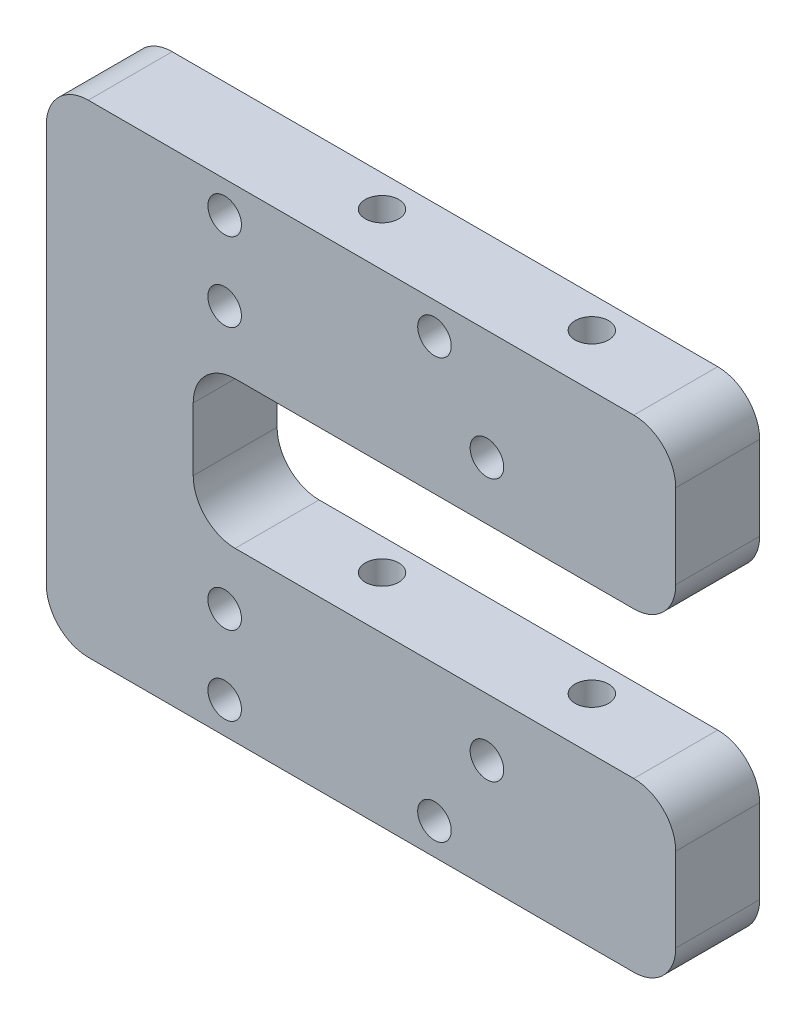
from build123d import *

# Parameters (mm, degrees)
SKETCH_1_R          = 1.6
EXTRUDE_1_DEPTH     = 8
FILLET_1_R          = 4
SKETCH_2_R          = 1.6
CUT_EXTRUDE_1_DEPTH = 10
SKETCH_3_R          = 1.6
CUT_EXTRUDE_2_DEPTH = 67


with BuildPart() as part:
    # 草图1 → 凸台-拉伸1 (new body)
    with BuildSketch(Plane.XY):
        Polygon((0, 46), (0, 0), (60, 0), (60, 16), (14, 16), (14, 30), (60, 30), (60, 46), align=None)
        with Locations((17, 35.5)):
            Circle(SKETCH_1_R, mode=Mode.SUBTRACT)
        with Locations((42, 35.5)):
            Circle(SKETCH_1_R, mode=Mode.SUBTRACT)
        with Locations((42, 10.5)):
            Circle(SKETCH_1_R, mode=Mode.SUBTRACT)
        with Locations((17, 10.5)):
            Circle(SKETCH_1_R, mode=Mode.SUBTRACT)
    extrude(amount=EXTRUDE_1_DEPTH)

    # 圆角1
    fillet_1_edges = [part.edges().sort_by_distance(p)[0] for p in [
        (0, 46, 4),
        (60, 46, 4),
        (60, 30, 4),
        (14, 30, 4),
        (14, 16, 4),
        (60, 16, 4),
        (0, 0, 4),
        (60, 0, 4),
    ]]
    fillet(fillet_1_edges, radius=FILLET_1_R)

    # 草图2 → 切除-拉伸1 (cut)
    with BuildSketch(Plane.XY.offset(8)):
        with Locations((17, 3)):
            Circle(SKETCH_2_R)
        with Locations((37, 3)):
            Circle(SKETCH_2_R)
        with Locations((37, 43)):
            Circle(SKETCH_2_R)
        with Locations((17, 43)):
            Circle(SKETCH_2_R)
    extrude(amount=-CUT_EXTRUDE_1_DEPTH, mode=Mode.SUBTRACT)

    # 草图3 → 切除-拉伸2 (cut)
    with BuildSketch(Plane(origin=(0, 46, 0), x_dir=(1, 0, 0), z_dir=(0, 1, 0))):
        with Locations((27, -3)):
            Circle(SKETCH_3_R)
        with Locations((47, -3)):
            Circle(SKETCH_3_R)
    extrude(amount=-CUT_EXTRUDE_2_DEPTH, mode=Mode.SUBTRACT)


solid = part.part
